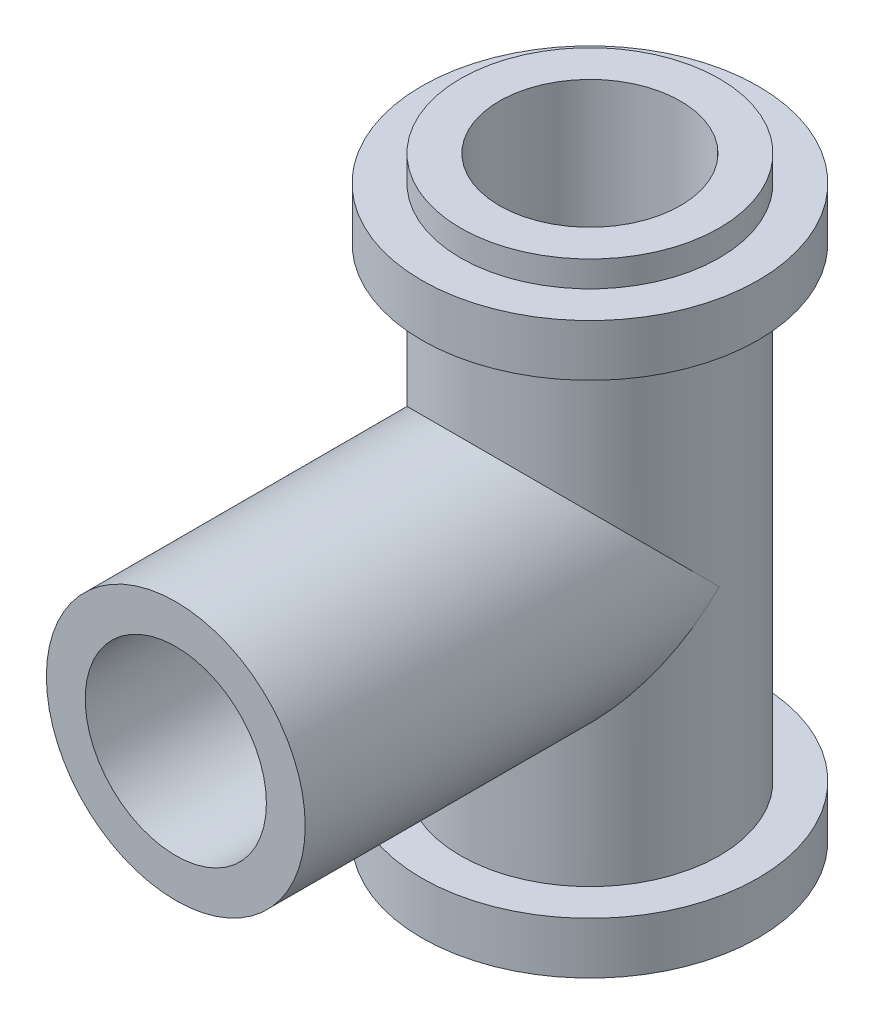
from build123d import *

# Parameters (mm, degrees)
SKETCH2_R           = 25
BOSS_EXTRUDE1_DEPTH = 120
SKETCH3_R           = 25
BOSS_EXTRUDE2_DEPTH = 80
SHELL1_OUTLINE_R    = 17.5
SHELL1_DEPTH        = 120
SHELL1_START        = -1e-07
SHELL1_2_OUTLINE_R  = 17.5
SHELL1_2_DEPTH      = 80.0000001
BOSS_EXTRUDE3_START = -5
SKETCH4_R           = 32.5
BOSS_EXTRUDE3_DEPTH = 10
SKETCH5_R           = 17.5
CUT_EXTRUDE1_DEPTH  = 144.809770183


with BuildPart() as part:
    # Sketch2 → Boss-Extrude1 (new body)
    with BuildSketch(Plane(origin=(0, 0, 0), x_dir=(1, 0, 0), z_dir=(0, 1, 0))):
        with Locations(Location((0, 0, 0), (0, 0, 270))):
            Circle(SKETCH2_R)
    extrude(amount=BOSS_EXTRUDE1_DEPTH)

    # Sketch3 → Boss-Extrude2 (add)
    with BuildSketch(Plane.XY):
        with Locations((0, 60)):
            Circle(SKETCH3_R)
    extrude(amount=BOSS_EXTRUDE2_DEPTH)

    # Shell1: read off the stored shape, not the designer's step
    # Shell1 outline → Shell1 (cut)
    with BuildSketch(Plane(origin=(0, 0, 0), x_dir=(1, 0, 0), z_dir=(0, 1, 0))):
        Circle(SHELL1_OUTLINE_R)
    extrude(amount=SHELL1_DEPTH, mode=Mode.SUBTRACT)

    # Shell1 2 outline → Shell1 2 (cut)
    with BuildSketch(Plane.XY.offset(SHELL1_START)):
        with Locations((0, 60)):
            Circle(SHELL1_2_OUTLINE_R)
    extrude(amount=SHELL1_2_DEPTH, mode=Mode.SUBTRACT)

    # Sketch4 → Boss-Extrude3 (add)
    with BuildSketch(Plane.XZ.offset(BOSS_EXTRUDE3_START)):
        with Locations(Location((0, 0, 0), (0, 0, 270))):
            Circle(SKETCH4_R)
    boss_extrude3 = extrude(amount=-BOSS_EXTRUDE3_DEPTH)

    # Mirror1: Boss-Extrude3 across plane
    add(boss_extrude3.mirror(Plane.ZX.offset(60)))

    # Sketch5 → Cut-Extrude1 (cut, through all)
    with BuildSketch(Plane.XZ.offset(-5)):
        with Locations(Location((0, 0, 0), (0, 0, 90))):
            Circle(SKETCH5_R)
    extrude(amount=-CUT_EXTRUDE1_DEPTH, mode=Mode.SUBTRACT)


solid = part.part
